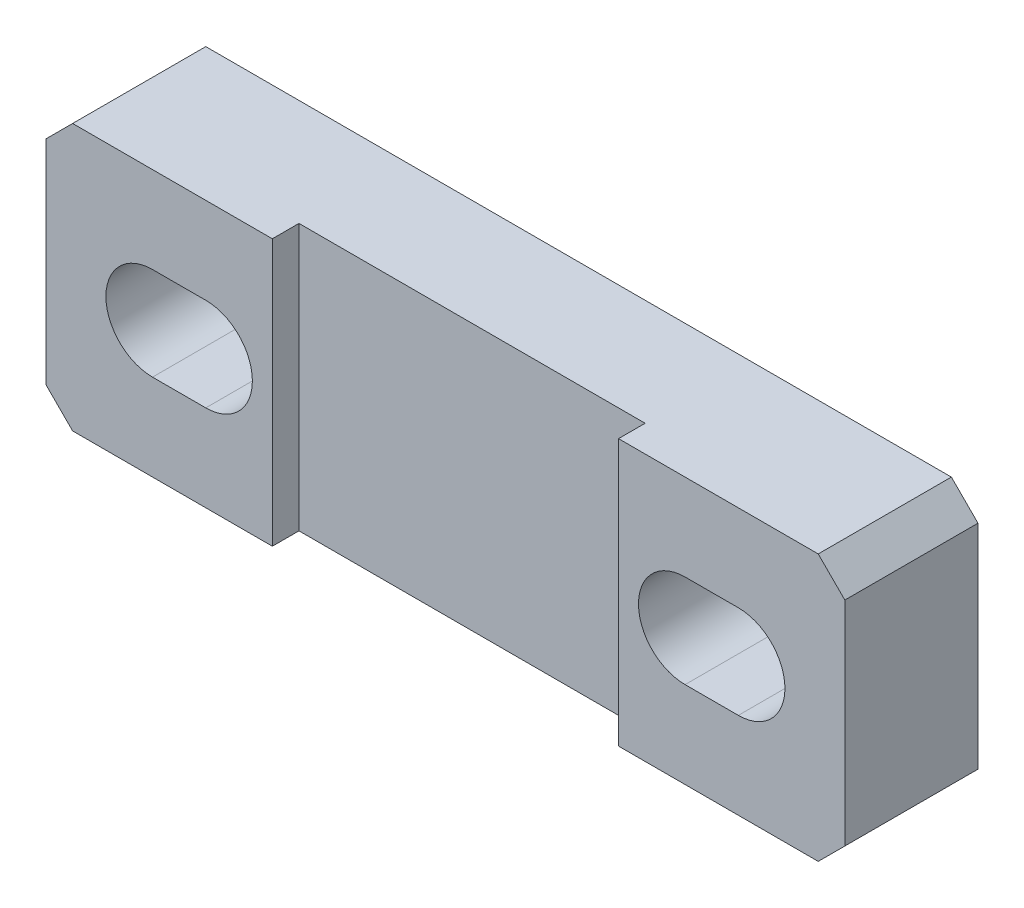
from build123d import *

# Parameters (mm, degrees)
SCHIZZO2_W                   = 30
SCHIZZO2_H                   = 10
ESTRUSIONE_ESTRUSIONE1_DEPTH = 5
SCHIZZO3_W                   = 13
SCHIZZO3_H                   = 10
TAGLIO_ESTRUSIONE1_DEPTH     = 1
SMUSSO1_SIZE                 = 1


with BuildPart() as part:
    # Schizzo2 → Estrusione-Estrusione1 (new body)
    with BuildSketch(Plane.XY):
        Rectangle(SCHIZZO2_W, SCHIZZO2_H)
        with BuildLine():
            Line((-9, -1.75), (-11, -1.75))
            ThreePointArc((-11, -1.75), (-12.75, 0), (-11, 1.75))
            Line((-11, 1.75), (-9, 1.75))
            ThreePointArc((-9, 1.75), (-7.25, 0), (-9, -1.75))
        make_face(mode=Mode.SUBTRACT)
        with BuildLine():
            Line((9, -1.75), (11, -1.75))
            ThreePointArc((11, -1.75), (12.75, 0), (11, 1.75))
            Line((11, 1.75), (9, 1.75))
            ThreePointArc((9, 1.75), (7.25, 0), (9, -1.75))
        make_face(mode=Mode.SUBTRACT)
    extrude(amount=-ESTRUSIONE_ESTRUSIONE1_DEPTH)

    # Schizzo3 → Taglio-Estrusione1 (cut)
    with BuildSketch(Plane.XY):
        Rectangle(SCHIZZO3_W, SCHIZZO3_H)
    extrude(amount=-TAGLIO_ESTRUSIONE1_DEPTH, mode=Mode.SUBTRACT)

    # Smusso1
    smusso1_edges = [part.edges().sort_by_distance(p)[0] for p in [
        (15, -5, -2.5),
        (15, 5, -2.5),
        (-15, -5, -2.5),
        (-15, 5, -2.5),
    ]]
    chamfer(smusso1_edges, length=SMUSSO1_SIZE)


solid = part.part
